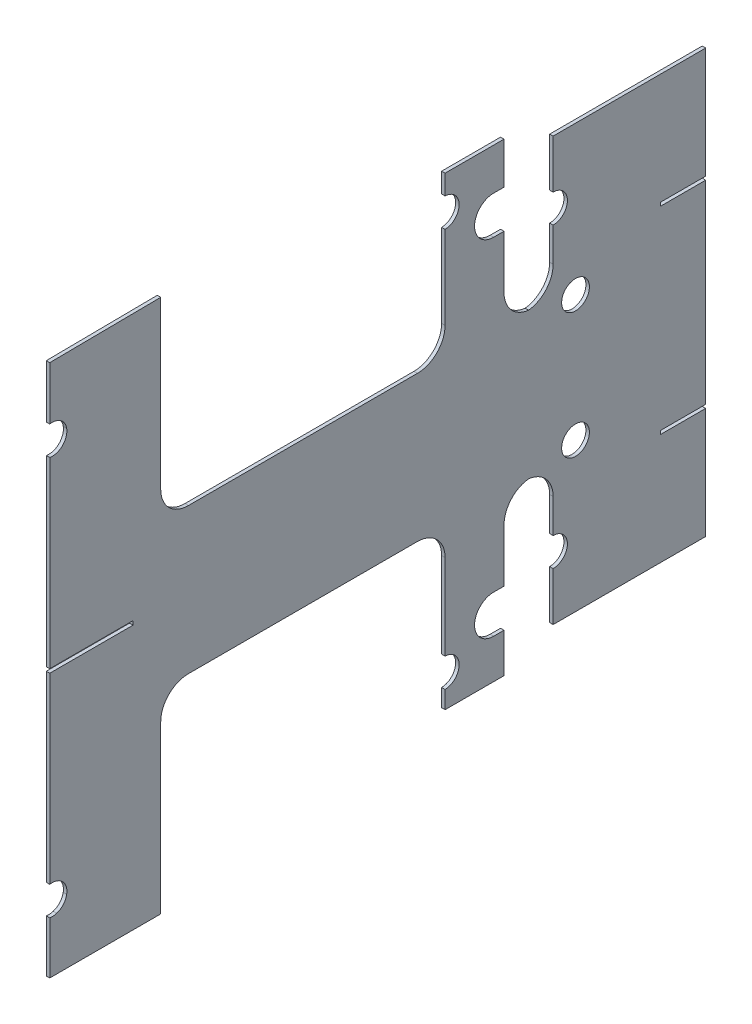
from build123d import *
from OCP.BRepAlgoAPI import BRepAlgoAPI_Cut
from OCP.TopTools import TopTools_ListOfShape

# Parameters (mm, degrees)
BOSS_EXTRUDE1_DEPTH = 1.5875
SKETCH2_R           = 13.081
CUT_EXTRUDE1_DEPTH  = 117.6782
CUT_EXTRUDE2_REACH  = 864.179
SKETCH3_R           = 13.081
SKETCH7_RX          = 13.456940142
SKETCH7_RY          = 13.355964413
CUT_EXTRUDE5_DEPTH  = 523.187556795
SKETCH9_RX          = 13.445467768
SKETCH9_RY          = 13.391794978
CUT_EXTRUDE6_DEPTH  = 523.187556795
SKETCH10_RX         = 13.456940142
SKETCH10_RY         = 13.397800125
CUT_EXTRUDE7_DEPTH  = 523.187556799
CUT_EXTRUDE8_REACH  = 572.923
SKETCH11_R          = 13.081
SKETCH19_RX         = 13.223312173
SKETCH19_RY         = 13.081030132
CUT_EXTRUDE13_DEPTH = 523.187556806
MIRROR1_START       = 1016
MIRROR1_DEPTH       = 5
FILLET1_START       = 1017.2446
FILLET1_DEPTH       = 3.175
CUT_EXTRUDE14_DEPTH = 523.187556802


with BuildPart() as part:
    # Sketch1 → Boss-Extrude1 (new, symmetric)
    with BuildSketch(Plane(origin=(1018.8321, 0, 0), x_dir=(0, 0, -1), z_dir=(1, 0, 0))):
        Polygon((-44.943661408, 213.749166265), (-98.918661408, 213.749166265), (-98.918661408, 67.699166265), (-359.268661408, 67.699166265), (-359.268661408, 245.499166265), (-460.868661408, 244.475), (-460.868661408, 66.675), (-460.868661408, 1.7907), (-384.668661408, 1.7907), (-384.668661408, -1.7907), (-460.868661408, -1.7907), (-460.868661408, -66.675), (-460.868661408, -243.450833735), (-359.268661408, -243.450833735), (-359.268661408, -65.650833735), (-98.918661408, -65.650833735), (-98.918661408, -211.700833735), (-44.943661408, -211.700833735), (-44.943661408, -66.675), (0, -66.675), (0, -193.675), (139.7, -193.675), (139.7, -92.075), (98.24556941, -92.075), (98.24556941, -88.9), (139.7, -88.9), (139.7, 88.9), (98.24556941, 88.9), (98.24556941, 92.075), (139.7, 92.075), (139.7, 193.675), (0, 193.675), (0, 66.675), (-44.943661408, 66.675), align=None)
        with BuildLine():
            add(Edge.make_bspline(
                [(21.556758498, -44.857666301), (-0.366066463, -43.052189708), (9.01360266, -63.161093791), (18.393271782, -83.269997873), (30.936427621, -64.966570384), (43.479583459, -46.663142895), (21.556758498, -44.857666301)],
                knots=[0, 0, 0, 2.094395102, 2.094395102, 4.188790205, 4.188790205, 6.283185307, 6.283185307, 6.283185307], degree=2, weights=[1, 0.5, 1, 0.5, 1, 0.5, 1]))
        make_face(mode=Mode.SUBTRACT)
        with BuildLine():
            add(Edge.make_bspline(
                [(21.556758498, 44.857666301), (43.479583459, 46.663142895), (30.936427621, 64.966570384), (18.393271782, 83.269997873), (9.01360266, 63.161093791), (-0.366066463, 43.052189708), (21.556758498, 44.857666301)],
                knots=[0, 0, 0, 2.094395102, 2.094395102, 4.188790205, 4.188790205, 6.283185307, 6.283185307, 6.283185307], degree=2, weights=[1, 0.5, 1, 0.5, 1, 0.5, 1]))
        make_face(mode=Mode.SUBTRACT)
    extrude(amount=BOSS_EXTRUDE1_DEPTH, both=True)

    # Sketch2 → Cut-Extrude1 (cut)
    with BuildSketch(Plane(origin=(1134.9228, 136.166603714, 0), x_dir=(0, 0, 1), z_dir=(-1, 0, 0))):
        Circle(SKETCH2_R)
    extrude(amount=CUT_EXTRUDE1_DEPTH, mode=Mode.SUBTRACT)

    # Cut-Extrude2: up to this plane
    cut_extrude2_end = Plane(origin=(1017.2446, 0, 0), z_dir=(1, 0, 0))
    # Sketch3 → Cut-Extrude2 (cut, up to the surface)
    with BuildSketch(Plane(origin=(1630.2228, 139.7, 330.2), x_dir=(0.2050222561191695, -0.014387526745204883, 0.9786515588144545), z_dir=(-0.9762506927412319, 0.06850882054324438, 0.20552646162973348)), mode=Mode.PRIVATE) as cut_extrude2_sk1:
        Circle(SKETCH3_R)
    cut_extrude2_tool1 = split(extrude(cut_extrude2_sk1.sketch, amount=CUT_EXTRUDE2_REACH, mode=Mode.PRIVATE), bisect_by=cut_extrude2_end, keep=Keep.BOTH, mode=Mode.PRIVATE)
    add(cut_extrude2_tool1.solids().sort_by_distance((1630.2228, 139.7, 330.2))[0], mode=Mode.SUBTRACT)

    # Sketch7 → Cut-Extrude5 (cut, through all)
    with BuildSketch(Plane.ZY.offset(-1017.2446)):
        with Locations(Location((458.579621053, 182.493207018), (0, 0, 80.206302576))):
            Ellipse(SKETCH7_RX, SKETCH7_RY)
    extrude(amount=-CUT_EXTRUDE5_DEPTH, mode=Mode.SUBTRACT)

    # Sketch9 → Cut-Extrude6 (cut, through all)
    with BuildSketch(Plane(origin=(1020.4196, 0, 0), x_dir=(0, 0, -1), z_dir=(1, 0, 0))):
        with Locations(Location((-458.579621053, 182.493207018), (0, 0, -99.802136374))):
            Ellipse(SKETCH9_RX, SKETCH9_RY)
    extrude(amount=-CUT_EXTRUDE6_DEPTH, mode=Mode.SUBTRACT)

    # Sketch10 → Cut-Extrude7 (cut, through all)
    with BuildSketch(Plane.ZY.offset(-1017.2446)):
        with Locations(Location((458.579621053, 182.493207018), (0, 0, 80.206302562))):
            Ellipse(SKETCH10_RX, SKETCH10_RY)
    extrude(amount=-CUT_EXTRUDE7_DEPTH, mode=Mode.SUBTRACT)

    # Cut-Extrude8: up to this plane
    cut_extrude8_end = Plane(origin=(1017.2446, 0, 0), z_dir=(1, 0, 0))
    # Sketch11 → Cut-Extrude8 (cut, up to the surface)
    with BuildSketch(Plane(origin=(1134.9228, 182.523820118, 99.41306), x_dir=(0.0021298200845781975, 1.9540206598432437e-06, -0.9999977319287225), z_dir=(0.9999973110652725, 0.0009174556197295962, 0.0021298209809440367)), mode=Mode.PRIVATE) as cut_extrude8_sk1:
        Circle(SKETCH11_R)
    cut_extrude8_tool1 = split(extrude(cut_extrude8_sk1.sketch, amount=-CUT_EXTRUDE8_REACH, mode=Mode.PRIVATE), bisect_by=cut_extrude8_end, keep=Keep.BOTH, mode=Mode.PRIVATE)
    add(cut_extrude8_tool1.solids().sort_by_distance((1134.9228, 182.52382, 99.41306))[0], mode=Mode.SUBTRACT)


with BuildPart() as cut_extrude13_tool:
    # Sketch19 → Cut-Extrude13 (new, through all)
    with BuildSketch(Plane.ZY.offset(-1017.2446)):
        with Locations(Location((99.162425827, 182.415855302), (0, 0, 91.056275717))):
            Ellipse(SKETCH19_RX, SKETCH19_RY)
    extrude(amount=-CUT_EXTRUDE13_DEPTH)


with BuildPart() as part_1:
    add(part.part)

    # Cut-Extrude13: cut by cut_extrude13_tool, with a tolerance
    cut_extrude13_stock = TopTools_ListOfShape()
    cut_extrude13_stock.Append(part_1.part.wrapped)
    cut_extrude13_tools = TopTools_ListOfShape()
    cut_extrude13_tools.Append(cut_extrude13_tool.part.wrapped)
    cut_extrude13_cut = BRepAlgoAPI_Cut()
    cut_extrude13_cut.SetArguments(cut_extrude13_stock)
    cut_extrude13_cut.SetTools(cut_extrude13_tools)
    cut_extrude13_cut.SetFuzzyValue(0.00001)
    cut_extrude13_cut.Build()
    add(Compound.cast(cut_extrude13_cut.Shape()).solids(), mode=Mode.REPLACE)

    # Mirror1: read off the stored shape, not the designer's step
    # Mirror1 outline → Mirror1 (cut)
    with BuildSketch(Plane.YZ.offset(MIRROR1_START)):
        with BuildLine():
            add(Edge.make_bspline(
                [(-184.772187594, 445.377072218), (-192.867269369, 446.753422284), (-195.322490897, 454.559086735)],
                knots=[1.911546311, 1.911546311, 1.911546311, 3.008453954, 3.008453954, 3.008453954], degree=2, weights=[1, 0.85333167, 1]))
            add(Edge.make_bspline(
                [(-184.772187594, 445.377072218), (-165.948609057, 442.127807973), (-169.239167993, 460.868661408)],
                knots=[1.570796327, 1.570796327, 1.570796327, 3.484936818, 3.484936818, 3.484936818], degree=2, weights=[1, 0.575917551, 1]))
            Line((-169.239167993, 460.868661408), (-195.754033999, 460.868661411))
            add(Edge.make_bspline(
                [(-195.754033999, 460.868661411), (-196.307414343, 457.662828466), (-195.322490897, 454.559086735)],
                knots=[0, 0, 0, 0.476417942, 0.476417942, 0.476417942], degree=2, weights=[1, 0.971762149, 1]))
        make_face()
        with BuildLine():
            Line((-169.194986689, 98.918661408), (-195.636920453, 98.918661408))
            add(Edge.make_bspline(
                [(-195.636920453, 98.918661408), (-195.40023147, 86.081347081), (-182.421128696, 86.081347081), (-169.442025922, 86.081347081), (-169.194986689, 98.918661408)],
                knots=[0, 0, 0, 1.552160362, 1.552160362, 3.104320723, 3.104320723, 3.104320723], degree=2, weights=[1, 0.713664798, 1, 0.713664798, 1]))
        make_face()
        with BuildLine():
            Line((-123.085603714, 0), (-149.247603714, 0))
            ThreePointArc((-149.247603714, 0), (-136.166603714, -13.081), (-123.085603714, 0))
        make_face()
    extrude(amount=MIRROR1_DEPTH, mode=Mode.SUBTRACT)

    # Fillet1: read off the stored shape, not the designer's step
    # Fillet1 outline → Fillet1 (add)
    with BuildSketch(Plane.YZ.offset(FILLET1_START)):
        with BuildLine():
            ThreePointArc((93.099166265, 98.918661408), (75.138654023, 106.358149166), (67.699166265, 124.318661408))
            Line((67.699166265, 124.318661408), (67.699166265, 98.918661408))
            Line((67.699166265, 98.918661408), (93.099166265, 98.918661408))
        make_face()
        with BuildLine():
            ThreePointArc((67.699166265, 333.868661408), (75.138654023, 351.82917365), (93.099166265, 359.268661408))
            Line((93.099166265, 359.268661408), (67.699166265, 359.268661408))
            Line((67.699166265, 359.268661408), (67.699166265, 333.868661408))
        make_face()
        with BuildLine():
            ThreePointArc((-91.050833735, 359.268661408), (-73.090321493, 351.82917365), (-65.650833735, 333.868661408))
            Line((-65.650833735, 333.868661408), (-65.650833735, 359.268661408))
            Line((-65.650833735, 359.268661408), (-91.050833735, 359.268661408))
        make_face()
        with BuildLine():
            Line((-65.650833735, 98.918661408), (-65.650833735, 124.318661408))
            ThreePointArc((-65.650833735, 124.318661408), (-73.090321493, 106.358149166), (-91.050833735, 98.918661408))
            Line((-91.050833735, 98.918661408), (-65.650833735, 98.918661408))
        make_face()
        with BuildLine():
            ThreePointArc((-66.84434752, 22.471830704), (-75.181443538, 6.43245535), (-92.075, 0))
            Line((-92.075, 0), (-66.675, 0))
            Line((-66.675, 0), (-66.675, 44.943661408))
            Line((-66.675, 44.943661408), (-92.075, 44.943661408))
            ThreePointArc((-92.075, 44.943661408), (-75.181443538, 38.511206058), (-66.84434752, 22.471830704))
        make_face()
        with BuildLine():
            ThreePointArc((92.075, 0), (75.181443538, 6.43245535), (66.84434752, 22.471830704))
            ThreePointArc((66.84434752, 22.471830704), (75.181443538, 38.511206058), (92.075, 44.943661408))
            Line((92.075, 44.943661408), (66.675, 44.943661408))
            Line((66.675, 44.943661408), (66.675, 0))
            Line((66.675, 0), (92.075, 0))
        make_face()
    extrude(amount=FILLET1_DEPTH)

    # Sketch20 → Cut-Extrude14 (cut, through all)
    with BuildSketch(Plane(origin=(1020.4196, 0, 0), x_dir=(0, 0, -1), z_dir=(1, 0, 0))):
        with BuildLine():
            Line((-54.468661408, 140.709369646), (-44.943661408, 140.709369646))
            Line((-44.943661408, 140.709369646), (-44.943661408, 175.649166265))
            Line((-44.943661408, 175.649166265), (-54.468661408, 175.649166265))
            ThreePointArc((-54.468661408, 175.649166265), (-71.938559718, 158.179267956), (-54.468661408, 140.709369646))
        make_face()
    cut_extrude14 = extrude(amount=-CUT_EXTRUDE14_DEPTH, mode=Mode.SUBTRACT)

    # Mirror2: Cut-Extrude14 across plane
    add(cut_extrude14.mirror(Plane.ZX), mode=Mode.SUBTRACT)


solid = part_1.part
